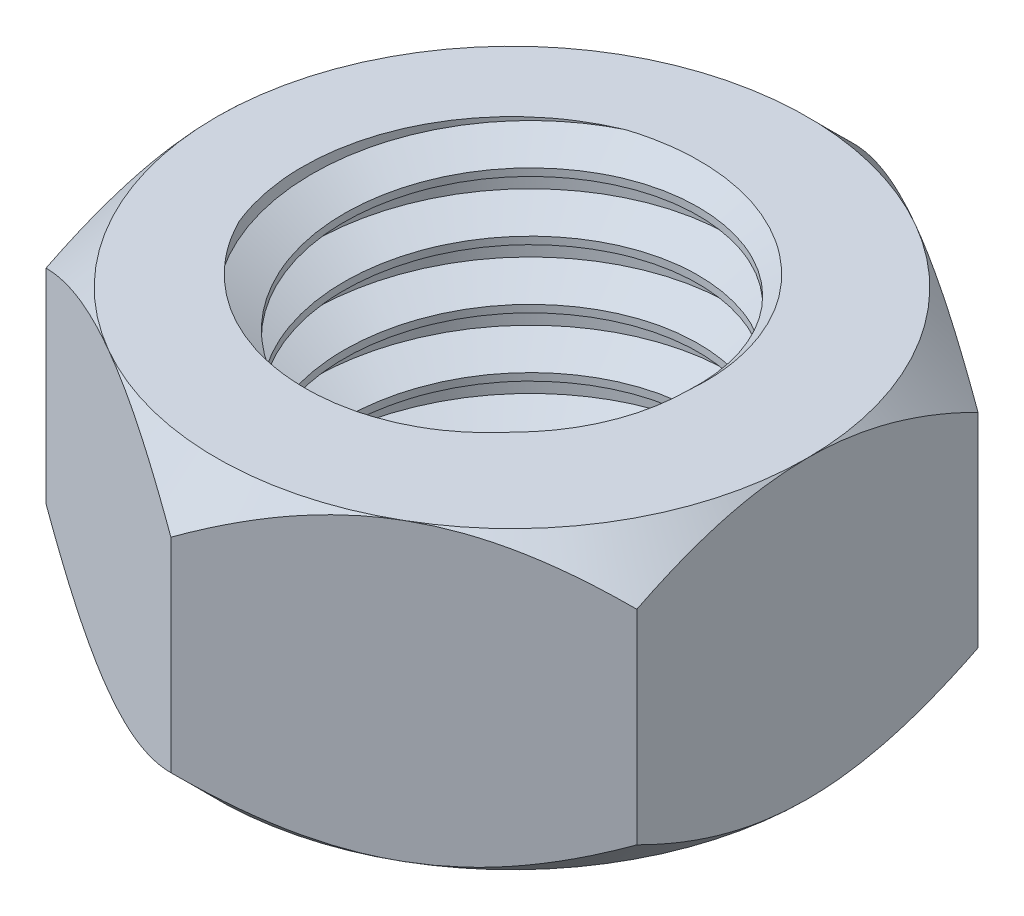
from build123d import *

# Parameters (mm, degrees)
BOSS_EXTRUDE1_DEPTH     = 2.5
SKETCH3_R               = 3
CUT_EXTRUDE4_DEPTH      = 10.128709292
SKETCH2_OUTSIDE_W       = 70.214
SKETCH2_OUTSIDE_H       = 71.762
SKETCH2_OUTSIDE_R       = 5
CUT_EXTRUDE5_DEPTH      = 27.5
CUT_EXTRUDE5_DRAFT      = -45
MIRROR2_COPY_1_SKETCH_W = 70.214
MIRROR2_COPY_1_SKETCH_H = 71.762
MIRROR2_COPY_1_SKETCH_R = 5
MIRROR2_COPY_1_DEPTH    = 27.5
MIRROR2_COPY_1_DRAFT    = -45
THREAD2_PITCH           = 1


with BuildPart() as part:
    # Sketch1 → Boss-Extrude1 (new, symmetric)
    with BuildSketch(Plane(origin=(0, 0, 0), x_dir=(1, 0, 0), z_dir=(0, 1, 0))):
        Polygon((5, -2.886751346), (5, 2.886751346), (0, 5.773502692), (-5, 2.886751346), (-5, -2.886751346), (0, -5.773502692), align=None)
    extrude(amount=BOSS_EXTRUDE1_DEPTH, both=True)

    # Sketch3 → Cut-Extrude4 (cut, through all)
    with BuildSketch(Plane.XZ.offset(2.5)):
        with Locations(Location((0, 0, 0), (0, 0, 270))):
            Circle(SKETCH3_R)
    extrude(amount=-CUT_EXTRUDE4_DEPTH, mode=Mode.SUBTRACT)


with BuildPart() as cut_extrude5_tool:
    # Sketch2 outside → Cut-Extrude5 (with draft: the straight prism first)
    with BuildSketch(Plane(origin=(0, 2.5, 0), x_dir=(1, 0, 0), z_dir=(0, 1, 0))):
        Rectangle(SKETCH2_OUTSIDE_W, SKETCH2_OUTSIDE_H)
        Circle(SKETCH2_OUTSIDE_R, mode=Mode.SUBTRACT)
    extrude(amount=-CUT_EXTRUDE5_DEPTH)
    # Cut-Extrude5: the draft: its side faces are tilted about the plane it starts from
    cut_extrude5_sides = [cut_extrude5_tool.faces().sort_by_distance(p)[0] for p in [
        (0, -11.25, 35.881),
        (35.107, -11.25, 0),
        (0, -11.25, -35.881),
        (-35.107, -11.25, 0),
        (-5, -11.25, 0),
    ]]
    draft(cut_extrude5_sides, Plane(origin=(0, 2.5, 0), x_dir=(1, 0, 0), z_dir=(0, 1, 0)), CUT_EXTRUDE5_DRAFT)


with BuildPart() as part_1:
    add(part.part)

    # Cut-Extrude5: cut by cut_extrude5_tool
    add(cut_extrude5_tool.part, mode=Mode.SUBTRACT)


with BuildPart() as mirror2_copy_1_tool:
    # Mirror2 copy 1 sketch → Mirror2 copy 1 (with draft: the straight prism first)
    with BuildSketch(Plane.XZ.offset(2.5)):
        Rectangle(MIRROR2_COPY_1_SKETCH_W, MIRROR2_COPY_1_SKETCH_H)
        Circle(MIRROR2_COPY_1_SKETCH_R, mode=Mode.SUBTRACT)
    extrude(amount=-MIRROR2_COPY_1_DEPTH)
    # Mirror2 copy 1: the draft: its side faces are tilted about the plane it starts from
    mirror2_copy_1_sides = [mirror2_copy_1_tool.faces().sort_by_distance(p)[0] for p in [
        (0, 11.25, 35.881),
        (35.107, 11.25, 0),
        (0, 11.25, -35.881),
        (-35.107, 11.25, 0),
        (-5, 11.25, 0),
    ]]
    draft(mirror2_copy_1_sides, Plane.XZ.offset(2.5), MIRROR2_COPY_1_DRAFT)


with BuildPart() as part_2:
    add(part_1.part)

    # Mirror2 copy 1: cut by mirror2_copy_1_tool
    add(mirror2_copy_1_tool.part, mode=Mode.SUBTRACT)

    # Thread2: the profile of Thread Profile2 profile screwed along a left-hand helix of 10 turns, 8 arcs to a turn; built about Z, then put on its axis
    thread2_z = Axis((0, 0, 0), (0, 0, 1))
    thread2_corners = [(2.9997, 0, 0.875173208), (2.9997, 0, -0.000173205), (3.54126588, 0, 0.312500002), (3.54126588, 0, 0.562500002)]
    with BuildLine(mode=Mode.PRIVATE) as thread2_profile:
        Line(thread2_corners[0], thread2_corners[1])
        Line(thread2_corners[1], thread2_corners[2])
        Line(thread2_corners[2], thread2_corners[3])
        Line(thread2_corners[3], thread2_corners[0])
    thread2_cap = Face(thread2_profile.wire())
    thread2_turn_angles = [0, -22.5, -45, -67.5, -90, -112.5, -135, -157.5, -180, -202.5, -225, -247.5, -270, -292.5, -315, -337.5, -360]
    thread2_turn_weights = [1, 0.9238795325112867, 1, 0.9238795325112867, 1, 0.9238795325112867, 1, 0.9238795325112867, 1, 0.9238795325112867, 1, 0.9238795325112867, 1, 0.9238795325112867, 1, 0.9238795325112867, 1]
    thread2_turn_rails = [Edge.make_bspline([Vector(p[0], p[1], 0).rotate(thread2_z, thread2_turn_angles[k]) / thread2_turn_weights[k] + Vector(0, 0, p[2] + -THREAD2_PITCH * thread2_turn_angles[k] / 360) for k in range(17)], [0, 0, 0, 1, 1, 2, 2, 3, 3, 4, 4, 5, 5, 6, 6, 7, 7, 8, 8, 8], 2, thread2_turn_weights) for p in thread2_corners]
    thread2_turn_sides = [Face.make_surface_from_curves(thread2_turn_rails[p[0]], thread2_turn_rails[p[1]]) for p in [(0, 1), (1, 2), (2, 3), (3, 0)]]
    thread2 = Plane(origin=(0, -4.5, 0), x_dir=(1, 0, 0), z_dir=(0, 1, 0)) * Solid(Shell([*[p.moved(Location((0, 0, THREAD2_PITCH * i))) for i in range(10) for p in thread2_turn_sides], thread2_cap, thread2_cap.rotate(thread2_z, -3600).moved(Location((0, 0, -THREAD2_PITCH * -3600 / 360)))]))
    add(thread2, mode=Mode.SUBTRACT)


solid = part_2.part
